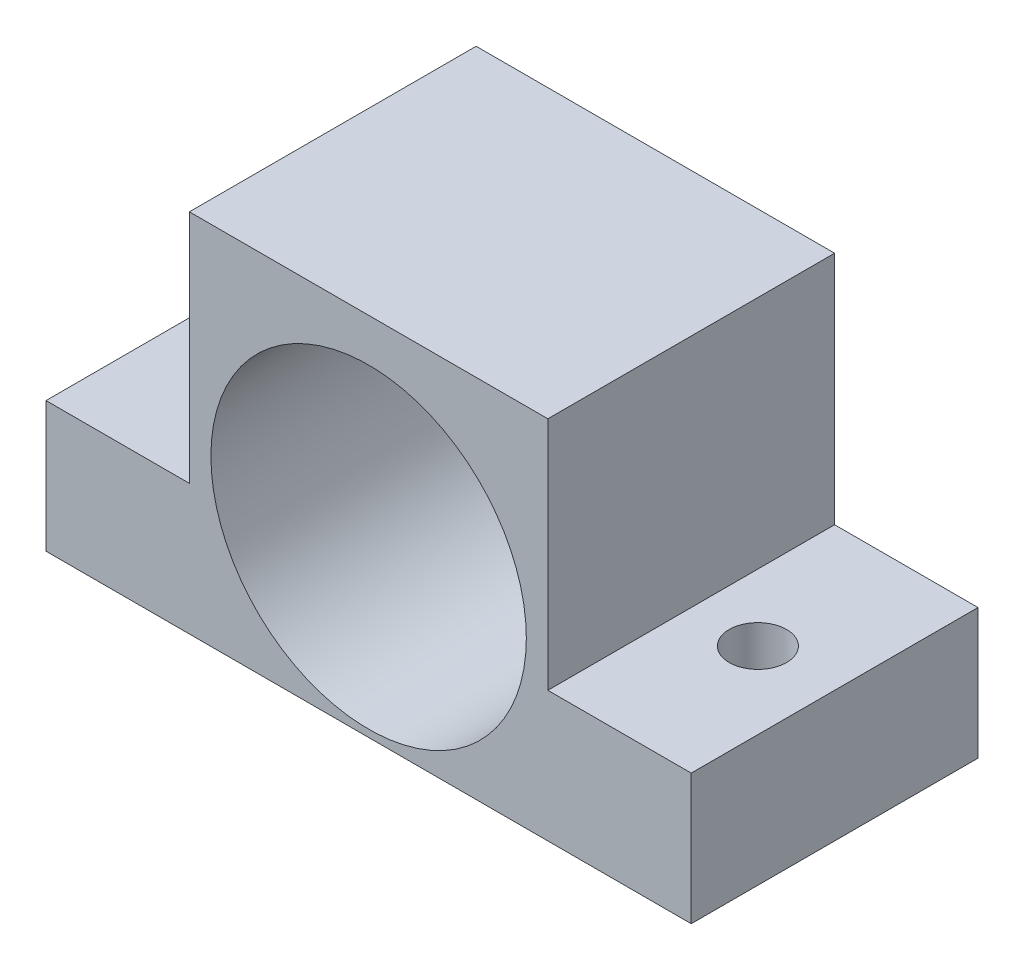
from build123d import *

# Parameters (mm, degrees)
SKETCH1_R           = 11
BOSS_EXTRUDE1_DEPTH = 20
SKETCH2_R           = 2
CUT_EXTRUDE1_DEPTH  = 9


with BuildPart() as part:
    # Sketch1 → Boss-Extrude1 (new body)
    with BuildSketch(Plane.XY):
        Polygon((13.551746227, 8), (-11.448253773, 8), (-11.448253773, -8.4), (-21.448253773, -8.4), (-21.448253773, -17.5), (23.551746227, -17.5), (23.551746227, -8.4), (13.551746227, -8.4), align=None)
        with Locations((1.051746227, -6)):
            Circle(SKETCH1_R, mode=Mode.SUBTRACT)
    extrude(amount=BOSS_EXTRUDE1_DEPTH)

    # Sketch2 → Cut-Extrude1 (cut)
    with BuildSketch(Plane(origin=(0, -8.4, 0), x_dir=(1, 0, 0), z_dir=(0, 1, 0))):
        with Locations((-16.798835848, -10)):
            Circle(SKETCH2_R)
        with Locations((18.201164152, -10)):
            Circle(SKETCH2_R)
    extrude(amount=-CUT_EXTRUDE1_DEPTH, mode=Mode.SUBTRACT)


solid = part.part
